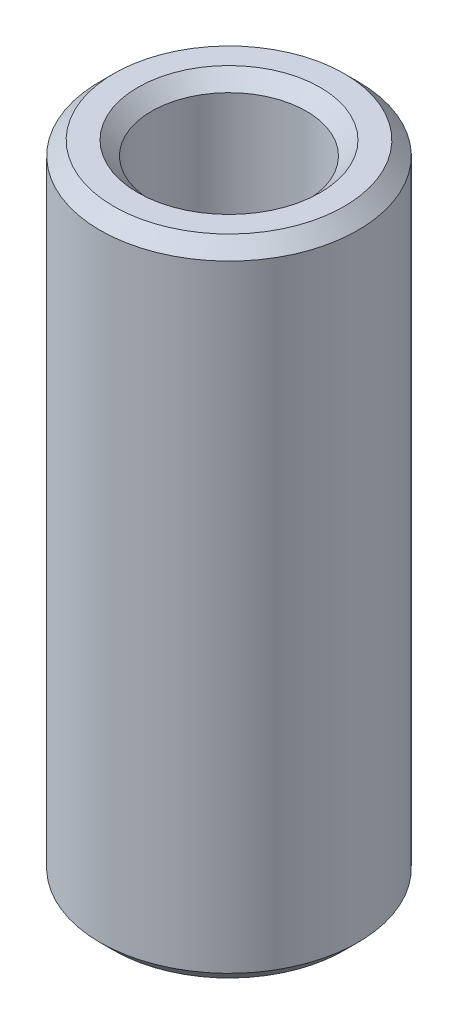
from build123d import *

# Parameters (mm, degrees)
SKETCH1_R           = 7.5
BOSS_EXTRUDE1_DEPTH = 37.48392719
SKETCH2_R           = 4.506342373
CUT_EXTRUDE1_DEPTH  = 39.955677347
CHAMFER1_SIZE       = 0.800417712


with BuildPart() as part:
    # Sketch1 → Boss-Extrude1 (new body)
    with BuildSketch(Plane(origin=(0, 0, 0), x_dir=(1, 0, 0), z_dir=(0, 1, 0))):
        Circle(SKETCH1_R)
    extrude(amount=BOSS_EXTRUDE1_DEPTH)

    # Sketch2 → Cut-Extrude1 (cut, through all)
    with BuildSketch(Plane(origin=(0, 0, 0), x_dir=(1, 0, 0), z_dir=(0, 1, 0))):
        Circle(SKETCH2_R)
    extrude(amount=CUT_EXTRUDE1_DEPTH, mode=Mode.SUBTRACT)

    # Chamfer1
    chamfer1_edges = [part.edges().sort_by_distance(p)[0] for p in [
        (-4.506342373, 37.48392719, 0),
        (-4.506342373, 0, 0),
        (-7.5, 0, 0),
        (-7.5, 37.48392719, 0),
    ]]
    chamfer(chamfer1_edges, length=CHAMFER1_SIZE)


solid = part.part
